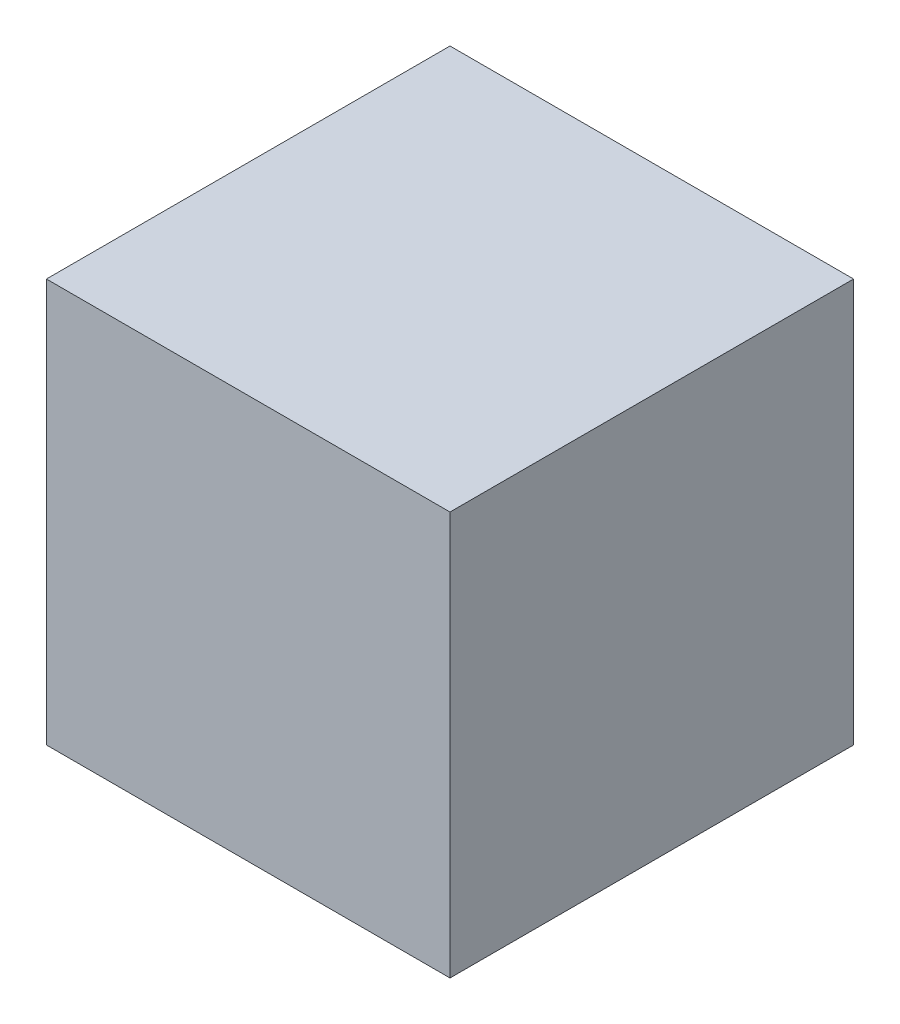
from build123d import *

# Parameters (mm, degrees)
BOSS_EXTRUDE1_DEPTH      = 500
BOSS_EXTRUDE1_DEPTH_BACK = 500
SKETCH1_W                = 1000
SKETCH1_H                = 1000


with BuildPart() as part:
    # Sketch1 → Boss-Extrude1 (new, two sides: drawn at the far end of the back side and taken through both)
    with BuildSketch(Plane(origin=(0, 0, 0), x_dir=(1, 0, 0), z_dir=(0, 1, 0)).offset(-BOSS_EXTRUDE1_DEPTH_BACK)):
        Rectangle(SKETCH1_W, SKETCH1_H)
    extrude(amount=BOSS_EXTRUDE1_DEPTH + BOSS_EXTRUDE1_DEPTH_BACK)


solid = part.part
